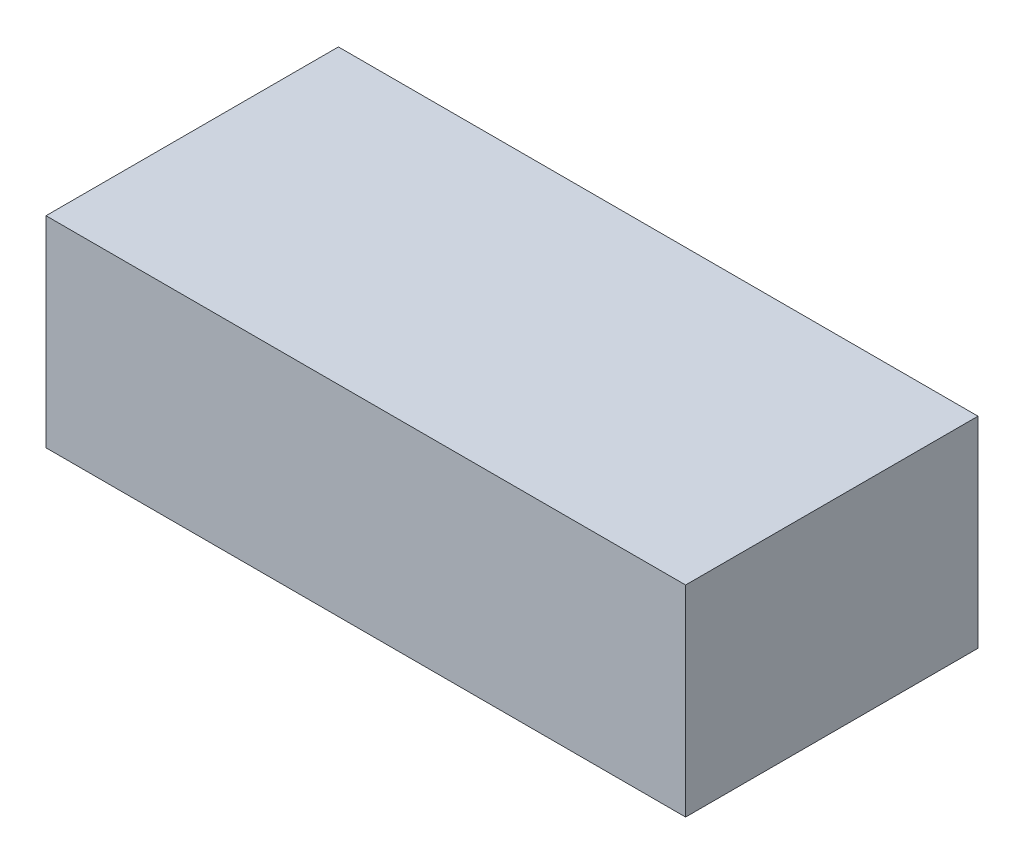
from build123d import *

# Parameters (mm, degrees)
SKETCH1_W           = 140
SKETCH1_H           = 64
BOSS_EXTRUDE1_DEPTH = 44


with BuildPart() as part:
    # Sketch1 → Boss-Extrude1 (new body)
    with BuildSketch(Plane(origin=(0, 0, 0), x_dir=(1, 0, 0), z_dir=(0, 1, 0))):
        Rectangle(SKETCH1_W, SKETCH1_H)
    extrude(amount=BOSS_EXTRUDE1_DEPTH)


solid = part.part
